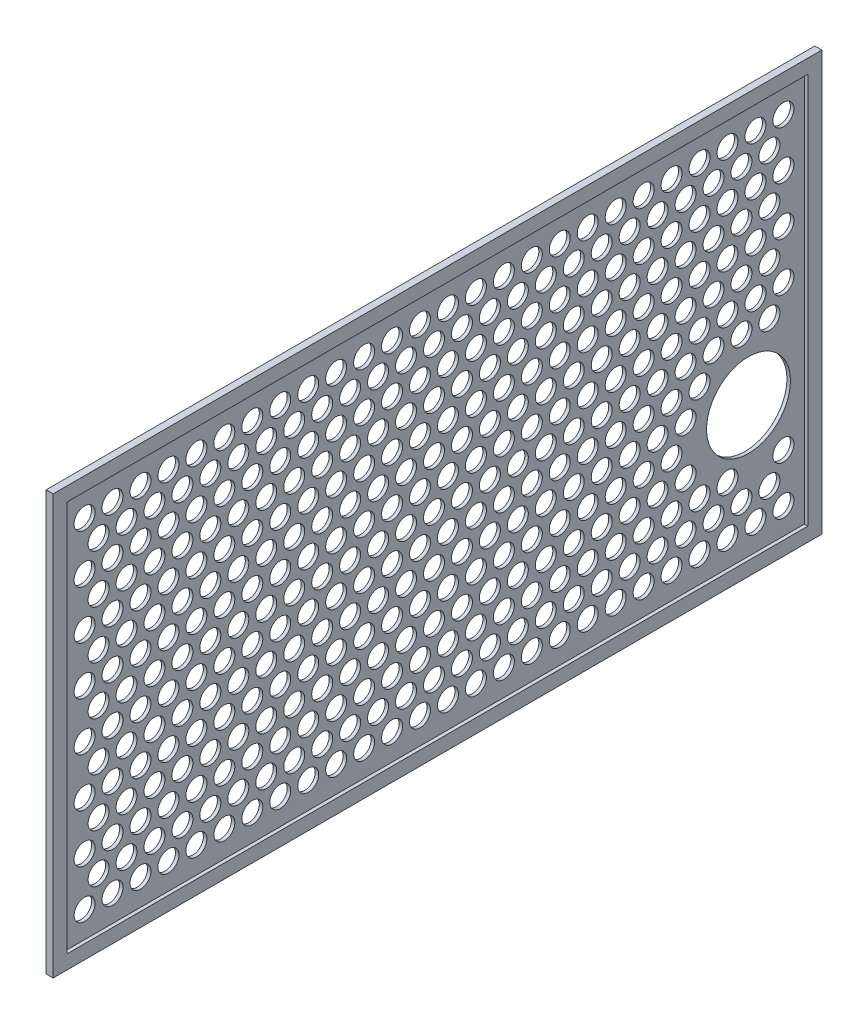
from build123d import *

# Parameters (mm, degrees)
SKETCH1_W               = 698.5
SKETCH1_H               = 381
BOSS_EXTRUDE1_DEPTH     = 3.175
SKETCH6_W               = 673.1
SKETCH6_H               = 355.6
CUT_EXTRUDE5_DEPTH      = 3.175
SKETCH2_R               = 38.1
CUT_EXTRUDE1_DEPTH      = 398.877035025
FILL_START              = -3.175
FILL_PATTERN1_OUTLINE_R = 9.525
FILL_PATTERN1_DEPTH     = 3.175


# Read off the part's stored shape, not the designer's step: Fill Pattern1
with BuildPart() as part:
    # Sketch1 → Boss-Extrude1 (new, symmetric)
    with BuildSketch(Plane(origin=(0, 0, 0), x_dir=(0, 0, -1), z_dir=(1, 0, 0))):
        Rectangle(SKETCH1_W, SKETCH1_H)
    extrude(amount=BOSS_EXTRUDE1_DEPTH, both=True)

    # Sketch6 → Cut-Extrude5 (cut)
    with BuildSketch(Plane(origin=(3.175, 0, 0), x_dir=(0, 0, -1), z_dir=(1, 0, 0))):
        Rectangle(SKETCH6_W, SKETCH6_H)
    extrude(amount=-CUT_EXTRUDE5_DEPTH, mode=Mode.SUBTRACT)

    # Sketch2 → Cut-Extrude1 (cut, through all)
    with BuildSketch(Plane.ZY.offset(3.175)):
        with Locations((-285.75, -58.7375)):
            Circle(SKETCH2_R)
    extrude(amount=-CUT_EXTRUDE1_DEPTH, mode=Mode.SUBTRACT)

    # Fill Pattern1 outline → Fill Pattern1 (cut)
    with BuildSketch(Plane.YZ.offset(FILL_START)):
        with Locations((-153.979316793, 317.5)):
            Circle(FILL_PATTERN1_OUTLINE_R)
        with Locations((87.988181024, -203.2)):
            Circle(FILL_PATTERN1_OUTLINE_R)
        with Locations((87.988181024, -228.6)):
            Circle(FILL_PATTERN1_OUTLINE_R)
        with Locations((87.988181024, -254)):
            Circle(FILL_PATTERN1_OUTLINE_R)
        with Locations((-131.982271537, 254)):
            Circle(FILL_PATTERN1_OUTLINE_R)
        with Locations((87.988181024, -304.8)):
            Circle(FILL_PATTERN1_OUTLINE_R)
        with Locations((87.988181024, -279.4)):
            Circle(FILL_PATTERN1_OUTLINE_R)
        with Locations((87.988181024, -177.8)):
            Circle(FILL_PATTERN1_OUTLINE_R)
        with Locations((87.988181024, -152.4)):
            Circle(FILL_PATTERN1_OUTLINE_R)
        with Locations((87.988181024, -127)):
            Circle(FILL_PATTERN1_OUTLINE_R)
        with Locations((87.988181024, -101.6)):
            Circle(FILL_PATTERN1_OUTLINE_R)
        with Locations((87.988181024, -76.2)):
            Circle(FILL_PATTERN1_OUTLINE_R)
        with Locations((-65.991135768, 266.7)):
            Circle(FILL_PATTERN1_OUTLINE_R)
        with Locations((-21.997045256, 266.7)):
            Circle(FILL_PATTERN1_OUTLINE_R)
        with Locations((21.997045256, 266.7)):
            Circle(FILL_PATTERN1_OUTLINE_R)
        with Locations((65.991135768, 266.7)):
            Circle(FILL_PATTERN1_OUTLINE_R)
        with Locations((65.991135768, 241.3)):
            Circle(FILL_PATTERN1_OUTLINE_R)
        with Locations((65.991135768, 215.9)):
            Circle(FILL_PATTERN1_OUTLINE_R)
        with Locations((65.991135768, 190.5)):
            Circle(FILL_PATTERN1_OUTLINE_R)
        with Locations((65.991135768, 165.1)):
            Circle(FILL_PATTERN1_OUTLINE_R)
        with Locations((65.991135768, 139.7)):
            Circle(FILL_PATTERN1_OUTLINE_R)
        with Locations((65.991135768, 114.3)):
            Circle(FILL_PATTERN1_OUTLINE_R)
        with Locations((65.991135768, 88.9)):
            Circle(FILL_PATTERN1_OUTLINE_R)
        with Locations((65.991135768, 63.5)):
            Circle(FILL_PATTERN1_OUTLINE_R)
        with Locations((87.988181024, 254)):
            Circle(FILL_PATTERN1_OUTLINE_R)
        with Locations((87.988181024, 279.4)):
            Circle(FILL_PATTERN1_OUTLINE_R)
        with Locations((43.994090512, 279.4)):
            Circle(FILL_PATTERN1_OUTLINE_R)
        with Locations((0, 279.4)):
            Circle(FILL_PATTERN1_OUTLINE_R)
        with Locations((-43.994090512, 279.4)):
            Circle(FILL_PATTERN1_OUTLINE_R)
        with Locations((-109.985226281, 266.7)):
            Circle(FILL_PATTERN1_OUTLINE_R)
        with Locations((109.985226281, -241.3)):
            Circle(FILL_PATTERN1_OUTLINE_R)
        with Locations((109.985226281, -266.7)):
            Circle(FILL_PATTERN1_OUTLINE_R)
        with Locations((-153.979316793, 266.7)):
            Circle(FILL_PATTERN1_OUTLINE_R)
        with Locations((109.985226281, -317.5)):
            Circle(FILL_PATTERN1_OUTLINE_R)
        with Locations((109.985226281, -292.1)):
            Circle(FILL_PATTERN1_OUTLINE_R)
        with Locations((87.988181024, 228.6)):
            Circle(FILL_PATTERN1_OUTLINE_R)
        with Locations((87.988181024, 203.2)):
            Circle(FILL_PATTERN1_OUTLINE_R)
        with Locations((87.988181024, 177.8)):
            Circle(FILL_PATTERN1_OUTLINE_R)
        with Locations((87.988181024, 152.4)):
            Circle(FILL_PATTERN1_OUTLINE_R)
        with Locations((87.988181024, 127)):
            Circle(FILL_PATTERN1_OUTLINE_R)
        with Locations((87.988181024, 101.6)):
            Circle(FILL_PATTERN1_OUTLINE_R)
        with Locations((87.988181024, 76.2)):
            Circle(FILL_PATTERN1_OUTLINE_R)
        with Locations((87.988181024, 50.8)):
            Circle(FILL_PATTERN1_OUTLINE_R)
        with Locations((87.988181024, 25.4)):
            Circle(FILL_PATTERN1_OUTLINE_R)
        with Locations((87.988181024, 0)):
            Circle(FILL_PATTERN1_OUTLINE_R)
        with Locations((87.988181024, -25.4)):
            Circle(FILL_PATTERN1_OUTLINE_R)
        with Locations((87.988181024, -50.8)):
            Circle(FILL_PATTERN1_OUTLINE_R)
        with Locations((43.994090512, 152.4)):
            Circle(FILL_PATTERN1_OUTLINE_R)
        with Locations((43.994090512, 127)):
            Circle(FILL_PATTERN1_OUTLINE_R)
        with Locations((43.994090512, 101.6)):
            Circle(FILL_PATTERN1_OUTLINE_R)
        with Locations((43.994090512, 76.2)):
            Circle(FILL_PATTERN1_OUTLINE_R)
        with Locations((43.994090512, 50.8)):
            Circle(FILL_PATTERN1_OUTLINE_R)
        with Locations((43.994090512, 25.4)):
            Circle(FILL_PATTERN1_OUTLINE_R)
        with Locations((43.994090512, 0)):
            Circle(FILL_PATTERN1_OUTLINE_R)
        with Locations((43.994090512, -25.4)):
            Circle(FILL_PATTERN1_OUTLINE_R)
        with Locations((43.994090512, -50.8)):
            Circle(FILL_PATTERN1_OUTLINE_R)
        with Locations((43.994090512, -76.2)):
            Circle(FILL_PATTERN1_OUTLINE_R)
        with Locations((43.994090512, -101.6)):
            Circle(FILL_PATTERN1_OUTLINE_R)
        with Locations((-109.985226281, 241.3)):
            Circle(FILL_PATTERN1_OUTLINE_R)
        with Locations((43.994090512, -304.8)):
            Circle(FILL_PATTERN1_OUTLINE_R)
        with Locations((43.994090512, -279.4)):
            Circle(FILL_PATTERN1_OUTLINE_R)
        with Locations((-65.991135768, 241.3)):
            Circle(FILL_PATTERN1_OUTLINE_R)
        with Locations((-21.997045256, 241.3)):
            Circle(FILL_PATTERN1_OUTLINE_R)
        with Locations((21.997045256, 241.3)):
            Circle(FILL_PATTERN1_OUTLINE_R)
        with Locations((43.994090512, -254)):
            Circle(FILL_PATTERN1_OUTLINE_R)
        with Locations((43.994090512, -228.6)):
            Circle(FILL_PATTERN1_OUTLINE_R)
        with Locations((43.994090512, -203.2)):
            Circle(FILL_PATTERN1_OUTLINE_R)
        with Locations((43.994090512, -177.8)):
            Circle(FILL_PATTERN1_OUTLINE_R)
        with Locations((43.994090512, -152.4)):
            Circle(FILL_PATTERN1_OUTLINE_R)
        with Locations((43.994090512, -127)):
            Circle(FILL_PATTERN1_OUTLINE_R)
        with Locations((65.991135768, 38.1)):
            Circle(FILL_PATTERN1_OUTLINE_R)
        with Locations((65.991135768, 12.7)):
            Circle(FILL_PATTERN1_OUTLINE_R)
        with Locations((65.991135768, -12.7)):
            Circle(FILL_PATTERN1_OUTLINE_R)
        with Locations((65.991135768, -38.1)):
            Circle(FILL_PATTERN1_OUTLINE_R)
        with Locations((65.991135768, -63.5)):
            Circle(FILL_PATTERN1_OUTLINE_R)
        with Locations((65.991135768, -88.9)):
            Circle(FILL_PATTERN1_OUTLINE_R)
        with Locations((65.991135768, -114.3)):
            Circle(FILL_PATTERN1_OUTLINE_R)
        with Locations((65.991135768, -139.7)):
            Circle(FILL_PATTERN1_OUTLINE_R)
        with Locations((65.991135768, -165.1)):
            Circle(FILL_PATTERN1_OUTLINE_R)
        with Locations((65.991135768, -190.5)):
            Circle(FILL_PATTERN1_OUTLINE_R)
        with Locations((65.991135768, -215.9)):
            Circle(FILL_PATTERN1_OUTLINE_R)
        with Locations((43.994090512, 177.8)):
            Circle(FILL_PATTERN1_OUTLINE_R)
        with Locations((43.994090512, 203.2)):
            Circle(FILL_PATTERN1_OUTLINE_R)
        with Locations((43.994090512, 228.6)):
            Circle(FILL_PATTERN1_OUTLINE_R)
        with Locations((43.994090512, 254)):
            Circle(FILL_PATTERN1_OUTLINE_R)
        with Locations((0, 254)):
            Circle(FILL_PATTERN1_OUTLINE_R)
        with Locations((-43.994090512, 254)):
            Circle(FILL_PATTERN1_OUTLINE_R)
        with Locations((65.991135768, -241.3)):
            Circle(FILL_PATTERN1_OUTLINE_R)
        with Locations((65.991135768, -266.7)):
            Circle(FILL_PATTERN1_OUTLINE_R)
        with Locations((65.991135768, -292.1)):
            Circle(FILL_PATTERN1_OUTLINE_R)
        with Locations((65.991135768, -317.5)):
            Circle(FILL_PATTERN1_OUTLINE_R)
        with Locations((-153.979316793, 241.3)):
            Circle(FILL_PATTERN1_OUTLINE_R)
        with Locations((-87.988181024, 254)):
            Circle(FILL_PATTERN1_OUTLINE_R)
        with Locations((153.979316793, -38.1)):
            Circle(FILL_PATTERN1_OUTLINE_R)
        with Locations((153.979316793, -63.5)):
            Circle(FILL_PATTERN1_OUTLINE_R)
        with Locations((153.979316793, -88.9)):
            Circle(FILL_PATTERN1_OUTLINE_R)
        with Locations((153.979316793, -114.3)):
            Circle(FILL_PATTERN1_OUTLINE_R)
        with Locations((153.979316793, -139.7)):
            Circle(FILL_PATTERN1_OUTLINE_R)
        with Locations((153.979316793, -165.1)):
            Circle(FILL_PATTERN1_OUTLINE_R)
        with Locations((153.979316793, -190.5)):
            Circle(FILL_PATTERN1_OUTLINE_R)
        with Locations((153.979316793, -215.9)):
            Circle(FILL_PATTERN1_OUTLINE_R)
        with Locations((153.979316793, -241.3)):
            Circle(FILL_PATTERN1_OUTLINE_R)
        with Locations((153.979316793, -266.7)):
            Circle(FILL_PATTERN1_OUTLINE_R)
        with Locations((153.979316793, -292.1)):
            Circle(FILL_PATTERN1_OUTLINE_R)
        with Locations((131.982271537, 203.2)):
            Circle(FILL_PATTERN1_OUTLINE_R)
        with Locations((131.982271537, 228.6)):
            Circle(FILL_PATTERN1_OUTLINE_R)
        with Locations((131.982271537, 254)):
            Circle(FILL_PATTERN1_OUTLINE_R)
        with Locations((131.982271537, 279.4)):
            Circle(FILL_PATTERN1_OUTLINE_R)
        with Locations((131.982271537, 304.8)):
            Circle(FILL_PATTERN1_OUTLINE_R)
        with Locations((87.988181024, 304.8)):
            Circle(FILL_PATTERN1_OUTLINE_R)
        with Locations((153.979316793, -317.5)):
            Circle(FILL_PATTERN1_OUTLINE_R)
        with Locations((-153.979316793, 292.1)):
            Circle(FILL_PATTERN1_OUTLINE_R)
        with Locations((-109.985226281, 292.1)):
            Circle(FILL_PATTERN1_OUTLINE_R)
        with Locations((-65.991135768, 292.1)):
            Circle(FILL_PATTERN1_OUTLINE_R)
        with Locations((0, 304.8)):
            Circle(FILL_PATTERN1_OUTLINE_R)
        with Locations((43.994090512, 304.8)):
            Circle(FILL_PATTERN1_OUTLINE_R)
        with Locations((153.979316793, -12.7)):
            Circle(FILL_PATTERN1_OUTLINE_R)
        with Locations((153.979316793, 12.7)):
            Circle(FILL_PATTERN1_OUTLINE_R)
        with Locations((153.979316793, 38.1)):
            Circle(FILL_PATTERN1_OUTLINE_R)
        with Locations((153.979316793, 63.5)):
            Circle(FILL_PATTERN1_OUTLINE_R)
        with Locations((153.979316793, 88.9)):
            Circle(FILL_PATTERN1_OUTLINE_R)
        with Locations((153.979316793, 114.3)):
            Circle(FILL_PATTERN1_OUTLINE_R)
        with Locations((153.979316793, 139.7)):
            Circle(FILL_PATTERN1_OUTLINE_R)
        with Locations((153.979316793, 165.1)):
            Circle(FILL_PATTERN1_OUTLINE_R)
        with Locations((153.979316793, 190.5)):
            Circle(FILL_PATTERN1_OUTLINE_R)
        with Locations((153.979316793, 215.9)):
            Circle(FILL_PATTERN1_OUTLINE_R)
        with Locations((153.979316793, 241.3)):
            Circle(FILL_PATTERN1_OUTLINE_R)
        with Locations((153.979316793, 266.7)):
            Circle(FILL_PATTERN1_OUTLINE_R)
        with Locations((-87.988181024, 304.8)):
            Circle(FILL_PATTERN1_OUTLINE_R)
        with Locations((-131.982271537, 304.8)):
            Circle(FILL_PATTERN1_OUTLINE_R)
        with Locations((-21.997045256, 317.5)):
            Circle(FILL_PATTERN1_OUTLINE_R)
        with Locations((-65.991135768, 317.5)):
            Circle(FILL_PATTERN1_OUTLINE_R)
        with Locations((-109.985226281, 317.5)):
            Circle(FILL_PATTERN1_OUTLINE_R)
        with Locations((-43.994090512, 304.8)):
            Circle(FILL_PATTERN1_OUTLINE_R)
        with Locations((21.997045256, 317.5)):
            Circle(FILL_PATTERN1_OUTLINE_R)
        with Locations((65.991135768, 317.5)):
            Circle(FILL_PATTERN1_OUTLINE_R)
        with Locations((109.985226281, 317.5)):
            Circle(FILL_PATTERN1_OUTLINE_R)
        with Locations((153.979316793, 317.5)):
            Circle(FILL_PATTERN1_OUTLINE_R)
        with Locations((153.979316793, 292.1)):
            Circle(FILL_PATTERN1_OUTLINE_R)
        with Locations((109.985226281, -215.9)):
            Circle(FILL_PATTERN1_OUTLINE_R)
        with Locations((109.985226281, -190.5)):
            Circle(FILL_PATTERN1_OUTLINE_R)
        with Locations((109.985226281, -165.1)):
            Circle(FILL_PATTERN1_OUTLINE_R)
        with Locations((109.985226281, -139.7)):
            Circle(FILL_PATTERN1_OUTLINE_R)
        with Locations((109.985226281, -114.3)):
            Circle(FILL_PATTERN1_OUTLINE_R)
        with Locations((109.985226281, -88.9)):
            Circle(FILL_PATTERN1_OUTLINE_R)
        with Locations((109.985226281, -63.5)):
            Circle(FILL_PATTERN1_OUTLINE_R)
        with Locations((109.985226281, -38.1)):
            Circle(FILL_PATTERN1_OUTLINE_R)
        with Locations((109.985226281, -12.7)):
            Circle(FILL_PATTERN1_OUTLINE_R)
        with Locations((109.985226281, 12.7)):
            Circle(FILL_PATTERN1_OUTLINE_R)
        with Locations((109.985226281, 38.1)):
            Circle(FILL_PATTERN1_OUTLINE_R)
        with Locations((109.985226281, 63.5)):
            Circle(FILL_PATTERN1_OUTLINE_R)
        with Locations((109.985226281, 88.9)):
            Circle(FILL_PATTERN1_OUTLINE_R)
        with Locations((109.985226281, 114.3)):
            Circle(FILL_PATTERN1_OUTLINE_R)
        with Locations((109.985226281, 139.7)):
            Circle(FILL_PATTERN1_OUTLINE_R)
        with Locations((109.985226281, 165.1)):
            Circle(FILL_PATTERN1_OUTLINE_R)
        with Locations((109.985226281, 190.5)):
            Circle(FILL_PATTERN1_OUTLINE_R)
        with Locations((109.985226281, 215.9)):
            Circle(FILL_PATTERN1_OUTLINE_R)
        with Locations((109.985226281, 241.3)):
            Circle(FILL_PATTERN1_OUTLINE_R)
        with Locations((109.985226281, 266.7)):
            Circle(FILL_PATTERN1_OUTLINE_R)
        with Locations((109.985226281, 292.1)):
            Circle(FILL_PATTERN1_OUTLINE_R)
        with Locations((65.991135768, 292.1)):
            Circle(FILL_PATTERN1_OUTLINE_R)
        with Locations((21.997045256, 292.1)):
            Circle(FILL_PATTERN1_OUTLINE_R)
        with Locations((131.982271537, 177.8)):
            Circle(FILL_PATTERN1_OUTLINE_R)
        with Locations((131.982271537, 152.4)):
            Circle(FILL_PATTERN1_OUTLINE_R)
        with Locations((131.982271537, 127)):
            Circle(FILL_PATTERN1_OUTLINE_R)
        with Locations((131.982271537, 101.6)):
            Circle(FILL_PATTERN1_OUTLINE_R)
        with Locations((131.982271537, 76.2)):
            Circle(FILL_PATTERN1_OUTLINE_R)
        with Locations((131.982271537, 50.8)):
            Circle(FILL_PATTERN1_OUTLINE_R)
        with Locations((131.982271537, 25.4)):
            Circle(FILL_PATTERN1_OUTLINE_R)
        with Locations((131.982271537, 0)):
            Circle(FILL_PATTERN1_OUTLINE_R)
        with Locations((131.982271537, -25.4)):
            Circle(FILL_PATTERN1_OUTLINE_R)
        with Locations((131.982271537, -50.8)):
            Circle(FILL_PATTERN1_OUTLINE_R)
        with Locations((131.982271537, -76.2)):
            Circle(FILL_PATTERN1_OUTLINE_R)
        with Locations((-21.997045256, 292.1)):
            Circle(FILL_PATTERN1_OUTLINE_R)
        with Locations((-87.988181024, 279.4)):
            Circle(FILL_PATTERN1_OUTLINE_R)
        with Locations((-131.982271537, 279.4)):
            Circle(FILL_PATTERN1_OUTLINE_R)
        with Locations((131.982271537, -304.8)):
            Circle(FILL_PATTERN1_OUTLINE_R)
        with Locations((131.982271537, -279.4)):
            Circle(FILL_PATTERN1_OUTLINE_R)
        with Locations((131.982271537, -254)):
            Circle(FILL_PATTERN1_OUTLINE_R)
        with Locations((131.982271537, -228.6)):
            Circle(FILL_PATTERN1_OUTLINE_R)
        with Locations((131.982271537, -203.2)):
            Circle(FILL_PATTERN1_OUTLINE_R)
        with Locations((131.982271537, -177.8)):
            Circle(FILL_PATTERN1_OUTLINE_R)
        with Locations((131.982271537, -152.4)):
            Circle(FILL_PATTERN1_OUTLINE_R)
        with Locations((131.982271537, -127)):
            Circle(FILL_PATTERN1_OUTLINE_R)
        with Locations((131.982271537, -101.6)):
            Circle(FILL_PATTERN1_OUTLINE_R)
        with Locations((-109.985226281, -88.9)):
            Circle(FILL_PATTERN1_OUTLINE_R)
        with Locations((-109.985226281, -63.5)):
            Circle(FILL_PATTERN1_OUTLINE_R)
        with Locations((-109.985226281, -38.1)):
            Circle(FILL_PATTERN1_OUTLINE_R)
        with Locations((-109.985226281, -12.7)):
            Circle(FILL_PATTERN1_OUTLINE_R)
        with Locations((-109.985226281, 12.7)):
            Circle(FILL_PATTERN1_OUTLINE_R)
        with Locations((-109.985226281, 38.1)):
            Circle(FILL_PATTERN1_OUTLINE_R)
        with Locations((-109.985226281, 63.5)):
            Circle(FILL_PATTERN1_OUTLINE_R)
        with Locations((-109.985226281, 88.9)):
            Circle(FILL_PATTERN1_OUTLINE_R)
        with Locations((-109.985226281, 114.3)):
            Circle(FILL_PATTERN1_OUTLINE_R)
        with Locations((-109.985226281, 139.7)):
            Circle(FILL_PATTERN1_OUTLINE_R)
        with Locations((-109.985226281, 165.1)):
            Circle(FILL_PATTERN1_OUTLINE_R)
        with Locations((-153.979316793, 165.1)):
            Circle(FILL_PATTERN1_OUTLINE_R)
        with Locations((-87.988181024, -228.6)):
            Circle(FILL_PATTERN1_OUTLINE_R)
        with Locations((-87.988181024, -203.2)):
            Circle(FILL_PATTERN1_OUTLINE_R)
        with Locations((-87.988181024, -177.8)):
            Circle(FILL_PATTERN1_OUTLINE_R)
        with Locations((-87.988181024, -152.4)):
            Circle(FILL_PATTERN1_OUTLINE_R)
        with Locations((-87.988181024, -127)):
            Circle(FILL_PATTERN1_OUTLINE_R)
        with Locations((-87.988181024, -101.6)):
            Circle(FILL_PATTERN1_OUTLINE_R)
        with Locations((-87.988181024, -76.2)):
            Circle(FILL_PATTERN1_OUTLINE_R)
        with Locations((-87.988181024, -50.8)):
            Circle(FILL_PATTERN1_OUTLINE_R)
        with Locations((-87.988181024, -25.4)):
            Circle(FILL_PATTERN1_OUTLINE_R)
        with Locations((-87.988181024, 0)):
            Circle(FILL_PATTERN1_OUTLINE_R)
        with Locations((-87.988181024, 25.4)):
            Circle(FILL_PATTERN1_OUTLINE_R)
        with Locations((-65.991135768, 165.1)):
            Circle(FILL_PATTERN1_OUTLINE_R)
        with Locations((-65.991135768, 139.7)):
            Circle(FILL_PATTERN1_OUTLINE_R)
        with Locations((-65.991135768, 114.3)):
            Circle(FILL_PATTERN1_OUTLINE_R)
        with Locations((-65.991135768, 88.9)):
            Circle(FILL_PATTERN1_OUTLINE_R)
        with Locations((-65.991135768, 63.5)):
            Circle(FILL_PATTERN1_OUTLINE_R)
        with Locations((-65.991135768, 38.1)):
            Circle(FILL_PATTERN1_OUTLINE_R)
        with Locations((-65.991135768, 12.7)):
            Circle(FILL_PATTERN1_OUTLINE_R)
        with Locations((-65.991135768, -12.7)):
            Circle(FILL_PATTERN1_OUTLINE_R)
        with Locations((-65.991135768, -38.1)):
            Circle(FILL_PATTERN1_OUTLINE_R)
        with Locations((-65.991135768, -63.5)):
            Circle(FILL_PATTERN1_OUTLINE_R)
        with Locations((-65.991135768, -88.9)):
            Circle(FILL_PATTERN1_OUTLINE_R)
        with Locations((-87.988181024, 50.8)):
            Circle(FILL_PATTERN1_OUTLINE_R)
        with Locations((-87.988181024, 76.2)):
            Circle(FILL_PATTERN1_OUTLINE_R)
        with Locations((-87.988181024, 101.6)):
            Circle(FILL_PATTERN1_OUTLINE_R)
        with Locations((-87.988181024, 127)):
            Circle(FILL_PATTERN1_OUTLINE_R)
        with Locations((-87.988181024, 152.4)):
            Circle(FILL_PATTERN1_OUTLINE_R)
        with Locations((-87.988181024, 177.8)):
            Circle(FILL_PATTERN1_OUTLINE_R)
        with Locations((-65.991135768, -114.3)):
            Circle(FILL_PATTERN1_OUTLINE_R)
        with Locations((-65.991135768, -139.7)):
            Circle(FILL_PATTERN1_OUTLINE_R)
        with Locations((-65.991135768, -165.1)):
            Circle(FILL_PATTERN1_OUTLINE_R)
        with Locations((-131.982271537, 177.8)):
            Circle(FILL_PATTERN1_OUTLINE_R)
        with Locations((-65.991135768, -215.9)):
            Circle(FILL_PATTERN1_OUTLINE_R)
        with Locations((-65.991135768, -190.5)):
            Circle(FILL_PATTERN1_OUTLINE_R)
        with Locations((-153.979316793, -12.7)):
            Circle(FILL_PATTERN1_OUTLINE_R)
        with Locations((-153.979316793, 12.7)):
            Circle(FILL_PATTERN1_OUTLINE_R)
        with Locations((-153.979316793, 38.1)):
            Circle(FILL_PATTERN1_OUTLINE_R)
        with Locations((-153.979316793, 63.5)):
            Circle(FILL_PATTERN1_OUTLINE_R)
        with Locations((-153.979316793, 88.9)):
            Circle(FILL_PATTERN1_OUTLINE_R)
        with Locations((-153.979316793, 114.3)):
            Circle(FILL_PATTERN1_OUTLINE_R)
        with Locations((-131.982271537, -228.6)):
            Circle(FILL_PATTERN1_OUTLINE_R)
        with Locations((-131.982271537, -254)):
            Circle(FILL_PATTERN1_OUTLINE_R)
        with Locations((-153.979316793, 139.7)):
            Circle(FILL_PATTERN1_OUTLINE_R)
        with Locations((-131.982271537, -304.8)):
            Circle(FILL_PATTERN1_OUTLINE_R)
        with Locations((-131.982271537, -279.4)):
            Circle(FILL_PATTERN1_OUTLINE_R)
        with Locations((-153.979316793, -38.1)):
            Circle(FILL_PATTERN1_OUTLINE_R)
        with Locations((-153.979316793, -63.5)):
            Circle(FILL_PATTERN1_OUTLINE_R)
        with Locations((-153.979316793, -88.9)):
            Circle(FILL_PATTERN1_OUTLINE_R)
        with Locations((-153.979316793, -114.3)):
            Circle(FILL_PATTERN1_OUTLINE_R)
        with Locations((-153.979316793, -139.7)):
            Circle(FILL_PATTERN1_OUTLINE_R)
        with Locations((-153.979316793, -165.1)):
            Circle(FILL_PATTERN1_OUTLINE_R)
        with Locations((-153.979316793, -190.5)):
            Circle(FILL_PATTERN1_OUTLINE_R)
        with Locations((-153.979316793, -215.9)):
            Circle(FILL_PATTERN1_OUTLINE_R)
        with Locations((-153.979316793, -241.3)):
            Circle(FILL_PATTERN1_OUTLINE_R)
        with Locations((-153.979316793, -266.7)):
            Circle(FILL_PATTERN1_OUTLINE_R)
        with Locations((-153.979316793, -292.1)):
            Circle(FILL_PATTERN1_OUTLINE_R)
        with Locations((-153.979316793, -317.5)):
            Circle(FILL_PATTERN1_OUTLINE_R)
        with Locations((-131.982271537, 101.6)):
            Circle(FILL_PATTERN1_OUTLINE_R)
        with Locations((-131.982271537, 127)):
            Circle(FILL_PATTERN1_OUTLINE_R)
        with Locations((-131.982271537, 152.4)):
            Circle(FILL_PATTERN1_OUTLINE_R)
        with Locations((-109.985226281, -317.5)):
            Circle(FILL_PATTERN1_OUTLINE_R)
        with Locations((-109.985226281, -266.7)):
            Circle(FILL_PATTERN1_OUTLINE_R)
        with Locations((-109.985226281, -241.3)):
            Circle(FILL_PATTERN1_OUTLINE_R)
        with Locations((-109.985226281, -215.9)):
            Circle(FILL_PATTERN1_OUTLINE_R)
        with Locations((-109.985226281, -190.5)):
            Circle(FILL_PATTERN1_OUTLINE_R)
        with Locations((-109.985226281, -165.1)):
            Circle(FILL_PATTERN1_OUTLINE_R)
        with Locations((-109.985226281, -139.7)):
            Circle(FILL_PATTERN1_OUTLINE_R)
        with Locations((-109.985226281, -114.3)):
            Circle(FILL_PATTERN1_OUTLINE_R)
        with Locations((-131.982271537, 76.2)):
            Circle(FILL_PATTERN1_OUTLINE_R)
        with Locations((-131.982271537, 50.8)):
            Circle(FILL_PATTERN1_OUTLINE_R)
        with Locations((-131.982271537, 25.4)):
            Circle(FILL_PATTERN1_OUTLINE_R)
        with Locations((-131.982271537, 0)):
            Circle(FILL_PATTERN1_OUTLINE_R)
        with Locations((-131.982271537, -25.4)):
            Circle(FILL_PATTERN1_OUTLINE_R)
        with Locations((-131.982271537, -50.8)):
            Circle(FILL_PATTERN1_OUTLINE_R)
        with Locations((-131.982271537, -76.2)):
            Circle(FILL_PATTERN1_OUTLINE_R)
        with Locations((-131.982271537, -101.6)):
            Circle(FILL_PATTERN1_OUTLINE_R)
        with Locations((-131.982271537, -127)):
            Circle(FILL_PATTERN1_OUTLINE_R)
        with Locations((-131.982271537, -152.4)):
            Circle(FILL_PATTERN1_OUTLINE_R)
        with Locations((-131.982271537, -177.8)):
            Circle(FILL_PATTERN1_OUTLINE_R)
        with Locations((-131.982271537, -203.2)):
            Circle(FILL_PATTERN1_OUTLINE_R)
        with Locations((0, -279.4)):
            Circle(FILL_PATTERN1_OUTLINE_R)
        with Locations((0, -254)):
            Circle(FILL_PATTERN1_OUTLINE_R)
        with Locations((0, -228.6)):
            Circle(FILL_PATTERN1_OUTLINE_R)
        with Locations((0, -203.2)):
            Circle(FILL_PATTERN1_OUTLINE_R)
        with Locations((0, -177.8)):
            Circle(FILL_PATTERN1_OUTLINE_R)
        with Locations((0, -152.4)):
            Circle(FILL_PATTERN1_OUTLINE_R)
        with Locations((0, -127)):
            Circle(FILL_PATTERN1_OUTLINE_R)
        with Locations((0, -101.6)):
            Circle(FILL_PATTERN1_OUTLINE_R)
        with Locations((0, -76.2)):
            Circle(FILL_PATTERN1_OUTLINE_R)
        with Locations((0, -50.8)):
            Circle(FILL_PATTERN1_OUTLINE_R)
        with Locations((0, -25.4)):
            Circle(FILL_PATTERN1_OUTLINE_R)
        Circle(FILL_PATTERN1_OUTLINE_R)
        with Locations((0, 25.4)):
            Circle(FILL_PATTERN1_OUTLINE_R)
        with Locations((0, 50.8)):
            Circle(FILL_PATTERN1_OUTLINE_R)
        with Locations((0, 76.2)):
            Circle(FILL_PATTERN1_OUTLINE_R)
        with Locations((0, 101.6)):
            Circle(FILL_PATTERN1_OUTLINE_R)
        with Locations((0, 127)):
            Circle(FILL_PATTERN1_OUTLINE_R)
        with Locations((0, 152.4)):
            Circle(FILL_PATTERN1_OUTLINE_R)
        with Locations((0, 177.8)):
            Circle(FILL_PATTERN1_OUTLINE_R)
        with Locations((0, 203.2)):
            Circle(FILL_PATTERN1_OUTLINE_R)
        with Locations((0, 228.6)):
            Circle(FILL_PATTERN1_OUTLINE_R)
        with Locations((-43.994090512, 228.6)):
            Circle(FILL_PATTERN1_OUTLINE_R)
        with Locations((-87.988181024, 228.6)):
            Circle(FILL_PATTERN1_OUTLINE_R)
        with Locations((21.997045256, 215.9)):
            Circle(FILL_PATTERN1_OUTLINE_R)
        with Locations((21.997045256, 190.5)):
            Circle(FILL_PATTERN1_OUTLINE_R)
        with Locations((21.997045256, 165.1)):
            Circle(FILL_PATTERN1_OUTLINE_R)
        with Locations((21.997045256, 139.7)):
            Circle(FILL_PATTERN1_OUTLINE_R)
        with Locations((21.997045256, 114.3)):
            Circle(FILL_PATTERN1_OUTLINE_R)
        with Locations((21.997045256, 88.9)):
            Circle(FILL_PATTERN1_OUTLINE_R)
        with Locations((21.997045256, 63.5)):
            Circle(FILL_PATTERN1_OUTLINE_R)
        with Locations((21.997045256, 38.1)):
            Circle(FILL_PATTERN1_OUTLINE_R)
        with Locations((21.997045256, 12.7)):
            Circle(FILL_PATTERN1_OUTLINE_R)
        with Locations((21.997045256, -12.7)):
            Circle(FILL_PATTERN1_OUTLINE_R)
        with Locations((21.997045256, -38.1)):
            Circle(FILL_PATTERN1_OUTLINE_R)
        with Locations((21.997045256, -215.9)):
            Circle(FILL_PATTERN1_OUTLINE_R)
        with Locations((21.997045256, -241.3)):
            Circle(FILL_PATTERN1_OUTLINE_R)
        with Locations((21.997045256, -266.7)):
            Circle(FILL_PATTERN1_OUTLINE_R)
        with Locations((-131.982271537, 228.6)):
            Circle(FILL_PATTERN1_OUTLINE_R)
        with Locations((21.997045256, -317.5)):
            Circle(FILL_PATTERN1_OUTLINE_R)
        with Locations((21.997045256, -292.1)):
            Circle(FILL_PATTERN1_OUTLINE_R)
        with Locations((21.997045256, -190.5)):
            Circle(FILL_PATTERN1_OUTLINE_R)
        with Locations((21.997045256, -165.1)):
            Circle(FILL_PATTERN1_OUTLINE_R)
        with Locations((21.997045256, -139.7)):
            Circle(FILL_PATTERN1_OUTLINE_R)
        with Locations((21.997045256, -114.3)):
            Circle(FILL_PATTERN1_OUTLINE_R)
        with Locations((21.997045256, -88.9)):
            Circle(FILL_PATTERN1_OUTLINE_R)
        with Locations((21.997045256, -63.5)):
            Circle(FILL_PATTERN1_OUTLINE_R)
        with Locations((-131.982271537, 203.2)):
            Circle(FILL_PATTERN1_OUTLINE_R)
        with Locations((-87.988181024, 203.2)):
            Circle(FILL_PATTERN1_OUTLINE_R)
        with Locations((-43.994090512, 203.2)):
            Circle(FILL_PATTERN1_OUTLINE_R)
        with Locations((-43.994090512, 177.8)):
            Circle(FILL_PATTERN1_OUTLINE_R)
        with Locations((-43.994090512, 152.4)):
            Circle(FILL_PATTERN1_OUTLINE_R)
        with Locations((-43.994090512, 127)):
            Circle(FILL_PATTERN1_OUTLINE_R)
        with Locations((-43.994090512, 101.6)):
            Circle(FILL_PATTERN1_OUTLINE_R)
        with Locations((-43.994090512, 76.2)):
            Circle(FILL_PATTERN1_OUTLINE_R)
        with Locations((-43.994090512, 50.8)):
            Circle(FILL_PATTERN1_OUTLINE_R)
        with Locations((-43.994090512, 25.4)):
            Circle(FILL_PATTERN1_OUTLINE_R)
        with Locations((-43.994090512, 0)):
            Circle(FILL_PATTERN1_OUTLINE_R)
        with Locations((-65.991135768, 190.5)):
            Circle(FILL_PATTERN1_OUTLINE_R)
        with Locations((-109.985226281, 190.5)):
            Circle(FILL_PATTERN1_OUTLINE_R)
        with Locations((-153.979316793, 190.5)):
            Circle(FILL_PATTERN1_OUTLINE_R)
        with Locations((-43.994090512, -228.6)):
            Circle(FILL_PATTERN1_OUTLINE_R)
        with Locations((-43.994090512, -203.2)):
            Circle(FILL_PATTERN1_OUTLINE_R)
        with Locations((-43.994090512, -177.8)):
            Circle(FILL_PATTERN1_OUTLINE_R)
        with Locations((-43.994090512, -152.4)):
            Circle(FILL_PATTERN1_OUTLINE_R)
        with Locations((-43.994090512, -127)):
            Circle(FILL_PATTERN1_OUTLINE_R)
        with Locations((-43.994090512, -101.6)):
            Circle(FILL_PATTERN1_OUTLINE_R)
        with Locations((-43.994090512, -76.2)):
            Circle(FILL_PATTERN1_OUTLINE_R)
        with Locations((-43.994090512, -50.8)):
            Circle(FILL_PATTERN1_OUTLINE_R)
        with Locations((-43.994090512, -25.4)):
            Circle(FILL_PATTERN1_OUTLINE_R)
        with Locations((-21.997045256, 63.5)):
            Circle(FILL_PATTERN1_OUTLINE_R)
        with Locations((-21.997045256, 88.9)):
            Circle(FILL_PATTERN1_OUTLINE_R)
        with Locations((-21.997045256, 114.3)):
            Circle(FILL_PATTERN1_OUTLINE_R)
        with Locations((-21.997045256, 139.7)):
            Circle(FILL_PATTERN1_OUTLINE_R)
        with Locations((-21.997045256, 165.1)):
            Circle(FILL_PATTERN1_OUTLINE_R)
        with Locations((-21.997045256, 190.5)):
            Circle(FILL_PATTERN1_OUTLINE_R)
        with Locations((0, -304.8)):
            Circle(FILL_PATTERN1_OUTLINE_R)
        with Locations((-153.979316793, 215.9)):
            Circle(FILL_PATTERN1_OUTLINE_R)
        with Locations((-109.985226281, 215.9)):
            Circle(FILL_PATTERN1_OUTLINE_R)
        with Locations((-65.991135768, 215.9)):
            Circle(FILL_PATTERN1_OUTLINE_R)
        with Locations((-21.997045256, 215.9)):
            Circle(FILL_PATTERN1_OUTLINE_R)
        with Locations((-21.997045256, 38.1)):
            Circle(FILL_PATTERN1_OUTLINE_R)
        with Locations((-21.997045256, 12.7)):
            Circle(FILL_PATTERN1_OUTLINE_R)
        with Locations((-21.997045256, -12.7)):
            Circle(FILL_PATTERN1_OUTLINE_R)
        with Locations((-21.997045256, -38.1)):
            Circle(FILL_PATTERN1_OUTLINE_R)
        with Locations((-21.997045256, -63.5)):
            Circle(FILL_PATTERN1_OUTLINE_R)
        with Locations((-21.997045256, -88.9)):
            Circle(FILL_PATTERN1_OUTLINE_R)
        with Locations((-21.997045256, -114.3)):
            Circle(FILL_PATTERN1_OUTLINE_R)
        with Locations((-21.997045256, -139.7)):
            Circle(FILL_PATTERN1_OUTLINE_R)
        with Locations((-21.997045256, -165.1)):
            Circle(FILL_PATTERN1_OUTLINE_R)
        with Locations((-21.997045256, -190.5)):
            Circle(FILL_PATTERN1_OUTLINE_R)
        with Locations((-21.997045256, -215.9)):
            Circle(FILL_PATTERN1_OUTLINE_R)
        with Locations((-21.997045256, -241.3)):
            Circle(FILL_PATTERN1_OUTLINE_R)
    extrude(amount=FILL_PATTERN1_DEPTH, mode=Mode.SUBTRACT)


solid = part.part
